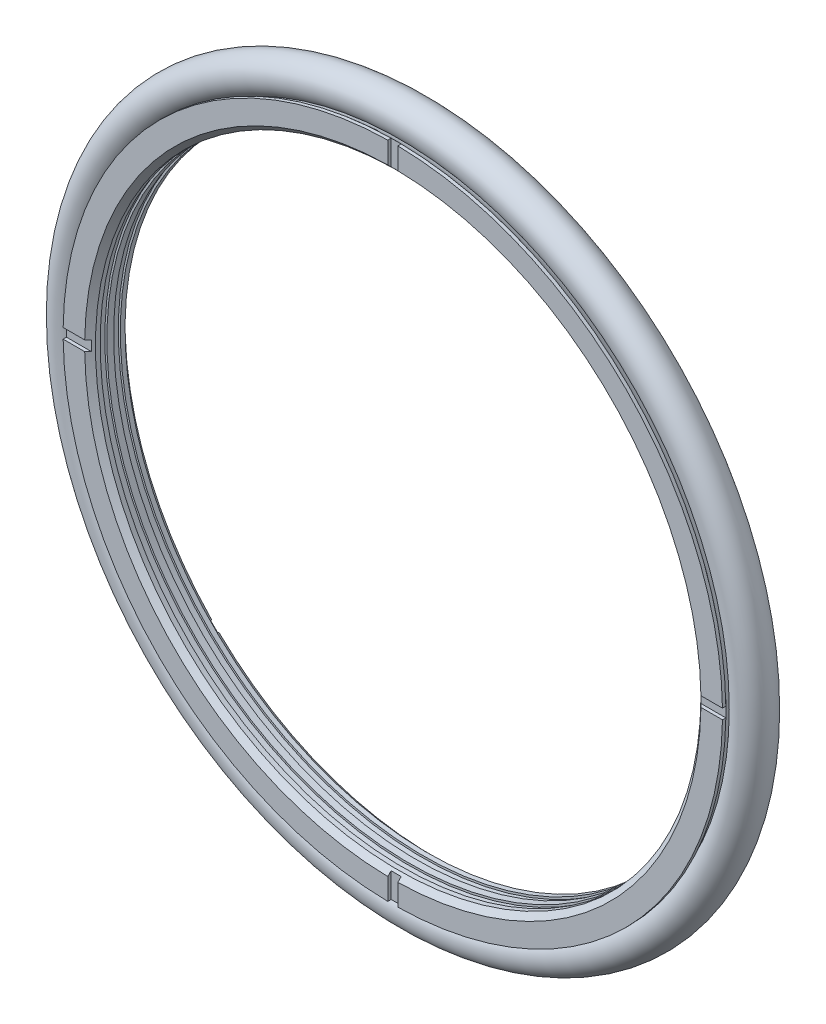
from build123d import *

# Parameters (mm, degrees)
SKETCH4_W          = 1.5
SKETCH4_H          = 6.449772914
CUT_EXTRUDE1_DEPTH = 0.5
CUT_EXTRUDE2_DEPTH = 0.5
CIRPATTERN1_COUNT  = 4
SKETCH2_R          = 2.65


with BuildPart() as part:
    # Sketch1 → Revolve1 (revolve)
    with BuildSketch(Plane(origin=(0, 0, 0), x_dir=(0, 0, -1), z_dir=(1, 0, 0))):
        with BuildLine():
            Line((-2.2, 45), (-1.5, 45))
            Line((-1.5, 45), (-1.5, 45.3))
            Line((-1.5, 45.3), (-0.5, 45.3))
            Line((-0.5, 45.3), (-0.5, 45))
            Line((-0.5, 45), (0.5, 45))
            Line((0.5, 45), (0.5, 45.3))
            Line((0.5, 45.3), (1.5, 45.3))
            Line((1.5, 45.3), (1.5, 45))
            Line((1.5, 45), (2.2, 45))
            Line((2.2, 45), (3, 45.8))
            Line((3, 45.8), (3, 49))
            Line((3, 49), (2.5, 49))
            ThreePointArc((2.5, 49), (0, 47.703720497), (-2.5, 49))
            Line((-2.5, 49), (-3, 49))
            Line((-3, 49), (-3, 45.8))
            Line((-3, 45.8), (-2.2, 45))
        make_face()
    revolve(axis=Axis((0, 0, 0), (0, 0, -1)))

    # Sketch4 → Cut-Extrude1 (cut)
    with BuildSketch(Plane.XY.offset(3)):
        with Locations((0, 47.20188555)):
            Rectangle(SKETCH4_W, SKETCH4_H)
    cut_extrude1 = extrude(amount=-CUT_EXTRUDE1_DEPTH, mode=Mode.SUBTRACT)

    # Sketch5 → Cut-Extrude2 (cut)
    with BuildSketch(Plane(origin=(0, 0, -3), x_dir=(-1, 0, 0), z_dir=(0, 0, -1))):
        Polygon((36.922611769, 35.861951597), (35.861951597, 36.922611769), (28.244140765, 29.304800937), (29.304800937, 28.244140765), align=None)
    cut_extrude2 = extrude(amount=-CUT_EXTRUDE2_DEPTH, mode=Mode.SUBTRACT)

    # CirPattern1: Cut-Extrude1, Cut-Extrude2 ×4 about axis
    cirpattern1_axis = Axis((0, 0, 0), (0, 0, 1))
    add([cut_extrude1.rotate(cirpattern1_axis, i * 360 / CIRPATTERN1_COUNT) for i in range(1, CIRPATTERN1_COUNT)], mode=Mode.SUBTRACT)
    add([cut_extrude2.rotate(cirpattern1_axis, i * 360 / CIRPATTERN1_COUNT) for i in range(1, CIRPATTERN1_COUNT)], mode=Mode.SUBTRACT)


with BuildPart() as body_2:
    # Sketch2 → Revolve2 (revolve)
    with BuildSketch(Plane(origin=(0, 0, 0), x_dir=(0, 0, -1), z_dir=(1, 0, 0))):
        with Locations((0, 50.75)):
            Circle(SKETCH2_R)
    revolve(axis=Axis((0, 0, 0), (0, 0, -1)))


solid = Compound([part.part, body_2.part])
